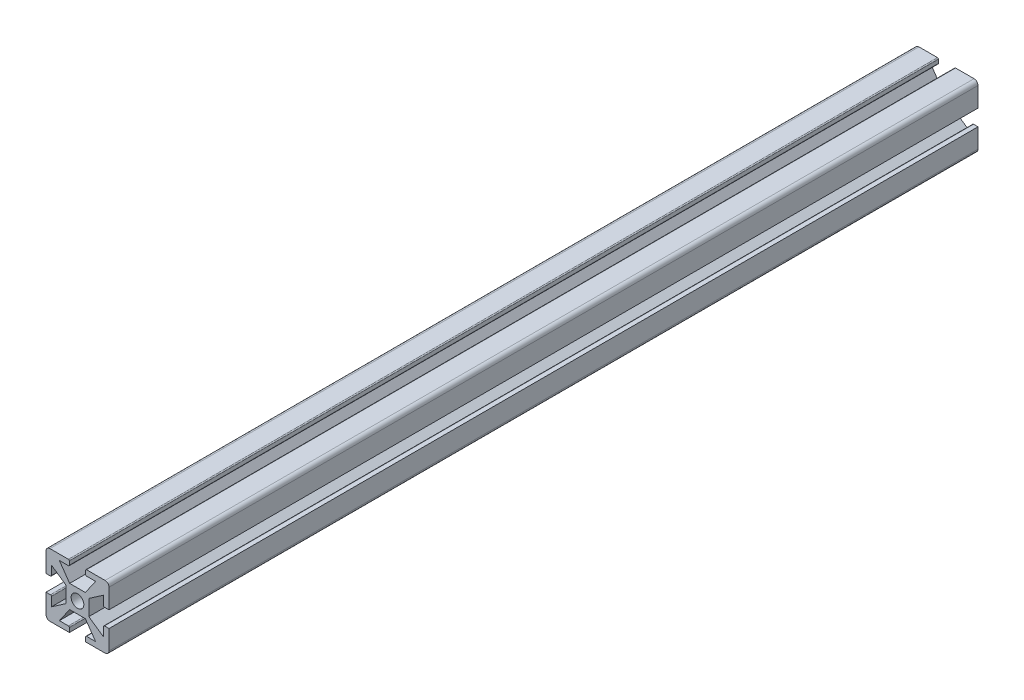
from build123d import *

# Parameters (mm, degrees)
SKETCH1_W           = 25.4
SKETCH1_H           = 25.4
BOSS_EXTRUDE1_DEPTH = 350.52
FILLET1_R           = 1.5875
HOLE1_OUTLINE_R     = 2.5527
HOLE1_DEPTH         = 350.52
SKETCH7_W           = 6.5278
SKETCH7_H           = 2.2352
CUT_EXTRUDE2_DEPTH  = 350.52
FILLET4_R           = 0.396875
CIRPATTERN2_DEPTH   = 350.52


# Read off the part's stored shape, not the designer's step: Hole1, CirPattern2
with BuildPart() as part:
    # Sketch1 → Boss-Extrude1 (new body)
    with BuildSketch(Plane.XY):
        Rectangle(SKETCH1_W, SKETCH1_H)
    extrude(amount=BOSS_EXTRUDE1_DEPTH)

    # Fillet1
    fillet1_edges = [part.edges().sort_by_distance(p)[0] for p in [
        (12.7, -12.7, 175.26),
        (-12.7, -12.7, 175.26),
        (-12.7, 12.7, 175.26),
        (12.7, 12.7, 175.26),
    ]]
    fillet(fillet1_edges, radius=FILLET1_R)

    # Hole1 outline → Hole1 (cut)
    with BuildSketch(Plane.XY):
        with Locations((0, -0.048792482)):
            Circle(HOLE1_OUTLINE_R)
    extrude(amount=HOLE1_DEPTH, mode=Mode.SUBTRACT)

    # Sketch7 → Cut-Extrude2 (cut)
    with BuildSketch(Plane.XY.offset(350.52)):
        with Locations((0, 11.5824)):
            Rectangle(SKETCH7_W, SKETCH7_H)
        Polygon((-3.175, 4.5212), (-7.3025, 10.4648), (7.3025, 10.4648), (3.175, 4.5212), align=None)
    extrude(amount=-CUT_EXTRUDE2_DEPTH, mode=Mode.SUBTRACT)

    # Fillet4
    fillet4_edges = [part.edges().sort_by_distance(p)[0] for p in [
        (-3.2639, 10.4648, 175.26),
        (-3.2639, 12.7, 175.26),
        (3.2639, 12.7, 175.26),
        (3.2639, 10.4648, 175.26),
    ]]
    fillet(fillet4_edges, radius=FILLET4_R)

    # CirPattern2 outline → CirPattern2 (cut)
    with BuildSketch(Plane.XY):
        with BuildLine():
            ThreePointArc((-3.660775, -10.562384964), (-3.380141996, -10.67862696), (-3.2639, -10.959259964))
            Line((-3.2639, -10.959259964), (-3.2639, -12.7))
            Line((-3.2639, -12.7), (3.2639, -12.7))
            Line((3.2639, -12.7), (3.2639, -10.959259964))
            ThreePointArc((3.2639, -10.959259964), (3.380141996, -10.67862696), (3.660775, -10.562384964))
            Line((3.660775, -10.562384964), (7.3025, -10.562384964))
            Line((7.3025, -10.562384964), (3.175, -4.618784964))
            Line((3.175, -4.618784964), (-3.175, -4.618784964))
            Line((-3.175, -4.618784964), (-7.3025, -10.562384964))
            Line((-7.3025, -10.562384964), (-3.660775, -10.562384964))
        make_face()
        with BuildLine():
            Line((-12.7, -3.312692482), (-10.910467482, -3.312692482))
            ThreePointArc((-10.910467482, -3.312692482), (-10.629834478, -3.428934478), (-10.513592482, -3.709567482))
            Line((-10.513592482, -3.709567482), (-10.513592482, -7.351292482))
            Line((-10.513592482, -7.351292482), (-4.569992482, -3.223792482))
            Line((-4.569992482, -3.223792482), (-4.569992482, 3.126207518))
            Line((-4.569992482, 3.126207518), (-10.513592482, 7.253707518))
            Line((-10.513592482, 7.253707518), (-10.513592482, 3.611982518))
            ThreePointArc((-10.513592482, 3.611982518), (-10.629834478, 3.331349514), (-10.910467482, 3.215107518))
            Line((-10.910467482, 3.215107518), (-12.7, 3.215107518))
            Line((-12.7, 3.215107518), (-12.7, -3.312692482))
        make_face()
        with BuildLine():
            ThreePointArc((10.513592482, -3.709567482), (10.629834478, -3.428934478), (10.910467482, -3.312692482))
            Line((10.910467482, -3.312692482), (12.7, -3.312692482))
            Line((12.7, -3.312692482), (12.7, 3.215107518))
            Line((12.7, 3.215107518), (10.910467482, 3.215107518))
            ThreePointArc((10.910467482, 3.215107518), (10.629834478, 3.331349514), (10.513592482, 3.611982518))
            Line((10.513592482, 3.611982518), (10.513592482, 7.253707518))
            Line((10.513592482, 7.253707518), (4.569992482, 3.126207518))
            Line((4.569992482, 3.126207518), (4.569992482, -3.223792482))
            Line((4.569992482, -3.223792482), (10.513592482, -7.351292482))
            Line((10.513592482, -7.351292482), (10.513592482, -3.709567482))
        make_face()
    extrude(amount=CIRPATTERN2_DEPTH, mode=Mode.SUBTRACT)


solid = part.part
